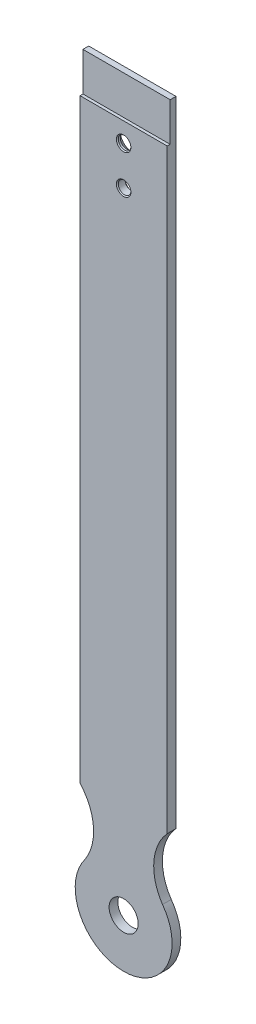
from build123d import *

# Parameters (mm, degrees)
SKETCH_1_R          = 3.25
SKETCH_1_R_2        = 7.5
EXTRUDE_1_DEPTH     = 4.5
SKETCH_2_W          = 1.5
SKETCH_2_H          = 19.943647813
CUT_EXTRUDE_1_DEPTH = 403.835574397
CHAMFER_1_SIZE      = 3
CHAMFER_2_SIZE      = 0.5


with BuildPart() as part:
    # Эскиз1 → Бобышка-Вытянуть1 (new body)
    with BuildSketch(Plane.XY):
        with BuildLine():
            Line((22.5, 72.811756372), (22.5, 400))
            Line((22.5, 400), (-22.5, 400))
            Line((-22.5, 400), (-22.5, 72.811756372))
            ThreePointArc((-22.5, 72.811756372), (-15.574584695, 56.789072088), (-20.05985163, 39.919864362))
            ThreePointArc((-20.05985163, 39.919864362), (0, 0), (20.05985163, 39.919864362))
            ThreePointArc((20.05985163, 39.919864362), (15.574584695, 56.789072088), (22.5, 72.811756372))
        make_face()
        with Locations((0, 370)):
            Circle(SKETCH_1_R, mode=Mode.SUBTRACT)
        with Locations((0, 350)):
            Circle(SKETCH_1_R, mode=Mode.SUBTRACT)
        with Locations((0, 25)):
            Circle(SKETCH_1_R_2, mode=Mode.SUBTRACT)
    extrude(amount=EXTRUDE_1_DEPTH)

    # Эскиз2 → Вырез-Вытянуть1 (cut, through all)
    with BuildSketch(Plane.ZY.offset(22.5)):
        with Locations((3.75, 390.028176094)):
            Rectangle(SKETCH_2_W, SKETCH_2_H)
    extrude(amount=-CUT_EXTRUDE_1_DEPTH, mode=Mode.SUBTRACT)

    # Фаска1
    chamfer_1_edges = [part.edges().sort_by_distance(p)[0] for p in [
        (-3.25, 370, 0),
    ]]
    chamfer(chamfer_1_edges, length=CHAMFER_1_SIZE)

    # Фаска2
    chamfer_2_edges = [part.edges().sort_by_distance(p)[0] for p in [
        (-3.25, 350, 0),
        (-3.25, 350, 4.5),
        (-3.25, 370, 4.5),
    ]]
    chamfer(chamfer_2_edges, length=CHAMFER_2_SIZE)


solid = part.part
